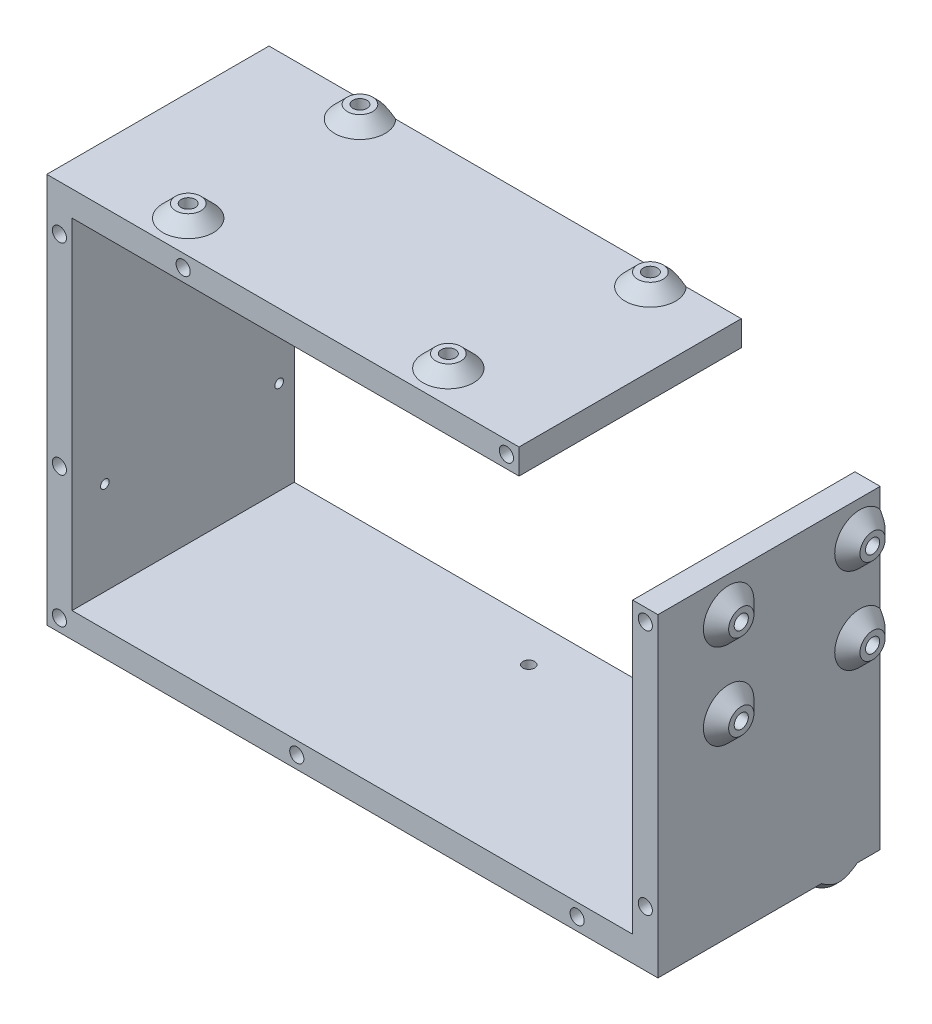
from build123d import *

# Parameters (mm, degrees)
SKETCH1_W                  = 121
SKETCH1_H                  = 77.3
BOX_DEPTH                  = 44
CUTOUT_REACH               = 86.203
SKETCH2_W                  = 111
SKETCH2_H                  = 67.3
TRIM_REACH                 = 86.203
SKETCH4_R                  = 1.4
TOP_SCREWS_DEPTH           = 9.5
SKETCH7_R                  = 2.5
USB_POWER_BOSS_DEPTH       = 2.5
CHAMFER2_SIZE              = 2.5
USB_POWER_SCREWS_REACH     = 131.945
SKETCH8_R                  = 0.85
SKETCH9_R                  = 2.5
MOTOR_DRIVERS_BOSS_DEPTH   = 2.5
CHAMFER3_SIZE              = 2.5
MOTOR_DRIVERS_SCREWS_REACH = 107.51
SKETCH11_R                 = 1.4
SKETCH12_R                 = 2.5
BOSS_EXTRUDE5_DEPTH        = 2.5
CUT_EXTRUDE8_REACH         = 109.238
SKETCH13_R                 = 1.15
CHAMFER4_SIZE              = 2.5
SKETCH14_R                 = 1.4
CHASSIS_SCREWS_DEPTH       = 10
SKETCH15_R                 = 5
LDS_ADAPTER_BOARD_DEPTH    = 2.5
CUT_EXTRUDE10_REACH        = 141.661
SKETCH16_R                 = 1.4


with BuildPart() as part:
    # Sketch1 → Box (new body)
    with BuildSketch(Plane.XY):
        Rectangle(SKETCH1_W, SKETCH1_H)
    extrude(amount=BOX_DEPTH)

    # Sketch2 → Cutout (cut, up to next)
    with BuildSketch(Plane.XY, mode=Mode.PRIVATE) as cutout_sk1:
        Rectangle(SKETCH2_W, SKETCH2_H)
    cutout_tool1 = extrude(cutout_sk1.sketch, amount=CUTOUT_REACH, mode=Mode.PRIVATE) & part.part
    add(cutout_tool1.solids().sort_by_distance((0, 0, 0))[0], mode=Mode.SUBTRACT)

    # Sketch3 → Trim (cut, up to next)
    with BuildSketch(Plane.XY, mode=Mode.PRIVATE) as trim_sk1:
        Polygon((33, 38.65), (33, 33.65), (55.5, 23.65), (60.5, 23.65), (60.5, 38.65), align=None)
    trim_tool1 = extrude(trim_sk1.sketch, amount=TRIM_REACH, mode=Mode.PRIVATE) & part.part
    add(trim_tool1.solids().sort_by_distance((49.09375, 32.7125, 0))[0], mode=Mode.SUBTRACT)

    # Sketch4 → Top screws (cut)
    with BuildSketch(Plane.XY.offset(44)):
        with Locations((-58, -36.15)):
            Circle(SKETCH4_R)
        with Locations((58, -27.65)):
            Circle(SKETCH4_R)
        with Locations((-11, -36.15)):
            Circle(SKETCH4_R)
        with Locations((-58, 29.65)):
            Circle(SKETCH4_R)
        with Locations((-33.5, 36.15)):
            Circle(SKETCH4_R)
        with Locations((30.5, 36.15)):
            Circle(SKETCH4_R)
        with Locations((58, 21.15)):
            Circle(SKETCH4_R)
        with Locations((44.5, -36.15)):
            Circle(SKETCH4_R)
        with Locations((-58, -10.15)):
            Circle(SKETCH4_R)
    extrude(amount=-TOP_SCREWS_DEPTH, mode=Mode.SUBTRACT)

    # Sketch7 → USB power boss (add)
    with BuildSketch(Plane.ZY.offset(60.5)):
        with Locations(Location((3, 32.8, 0), (0, 0, 90))):
            Circle(SKETCH7_R)
        with Locations(Location((37.5, 32.8, 0), (0, 0, 90))):
            Circle(SKETCH7_R)
        with Locations(Location((3, -15.2, 0), (0, 0, 90))):
            Circle(SKETCH7_R)
        with Locations(Location((37.5, -15.2, 0), (0, 0, 90))):
            Circle(SKETCH7_R)
    extrude(amount=USB_POWER_BOSS_DEPTH)

    # Chamfer2
    # the kernel refuses this chamfer: 2.5 mm, written as the material it adds along each edge
    with BuildSketch(Plane(origin=(-60.5, 32.8, 3), x_dir=(0, 1, 0), z_dir=(0, 0, 1))) as chamfer2_piece_1_section:
        Polygon((2.5 + CHAMFER2_SIZE, 0), (2.5, CHAMFER2_SIZE), (2.5, 0), align=None)
    chamfer2_piece_1 = revolve(axis=Axis((-60.5, 32.8, 3), (-1, 0, 0)), mode=Mode.PRIVATE)
    chamfer2_piece_1 = split(chamfer2_piece_1, bisect_by=Plane(origin=(-60.5, 32.8, 0), z_dir=(0, 0, 1)), keep=Keep.TOP, mode=Mode.PRIVATE)
    chamfer2_piece_1 = split(chamfer2_piece_1, bisect_by=Plane(origin=(-63, 32.8, 3), z_dir=(1, 0, 0)), keep=Keep.TOP, mode=Mode.PRIVATE)
    add(chamfer2_piece_1)
    with BuildSketch(Plane(origin=(-60.5, 32.8, 37.5), x_dir=(0, 1, 0), z_dir=(0, 0, 1))) as chamfer2_piece_2_section:
        Polygon((2.5 + CHAMFER2_SIZE, 0), (2.5, CHAMFER2_SIZE), (2.5, 0), align=None)
    chamfer2_piece_2 = revolve(axis=Axis((-60.5, 32.8, 37.5), (-1, 0, 0)), mode=Mode.PRIVATE)
    chamfer2_piece_2 = split(chamfer2_piece_2, bisect_by=Plane(origin=(-63, 32.8, 37.5), z_dir=(1, 0, 0)), keep=Keep.TOP, mode=Mode.PRIVATE)
    add(chamfer2_piece_2)
    with BuildSketch(Plane(origin=(-60.5, -15.2, 3), x_dir=(0, 1, 0), z_dir=(0, 0, 1))) as chamfer2_piece_3_section:
        Polygon((2.5 + CHAMFER2_SIZE, 0), (2.5, CHAMFER2_SIZE), (2.5, 0), align=None)
    chamfer2_piece_3 = revolve(axis=Axis((-60.5, -15.2, 3), (-1, 0, 0)), mode=Mode.PRIVATE)
    chamfer2_piece_3 = split(chamfer2_piece_3, bisect_by=Plane(origin=(-60.5, -15.2, 0), z_dir=(0, 0, 1)), keep=Keep.TOP, mode=Mode.PRIVATE)
    chamfer2_piece_3 = split(chamfer2_piece_3, bisect_by=Plane(origin=(-63, -15.2, 3), z_dir=(1, 0, 0)), keep=Keep.TOP, mode=Mode.PRIVATE)
    add(chamfer2_piece_3)
    with BuildSketch(Plane(origin=(-60.5, -15.2, 37.5), x_dir=(0, 1, 0), z_dir=(0, 0, 1))) as chamfer2_piece_4_section:
        Polygon((2.5 + CHAMFER2_SIZE, 0), (2.5, CHAMFER2_SIZE), (2.5, 0), align=None)
    chamfer2_piece_4 = revolve(axis=Axis((-60.5, -15.2, 37.5), (-1, 0, 0)), mode=Mode.PRIVATE)
    chamfer2_piece_4 = split(chamfer2_piece_4, bisect_by=Plane(origin=(-63, -15.2, 37.5), z_dir=(1, 0, 0)), keep=Keep.TOP, mode=Mode.PRIVATE)
    add(chamfer2_piece_4)

    # Sketch8 → USB power screws (cut, up to next)
    with BuildSketch(Plane(origin=(-55.5, 0, 0), x_dir=(0, 0, -1), z_dir=(1, 0, 0)), mode=Mode.PRIVATE) as usb_power_screws_sk1:
        with Locations((-3, -15.2)):
            Circle(SKETCH8_R)
    usb_power_screws_tool1 = extrude(usb_power_screws_sk1.sketch, amount=-USB_POWER_SCREWS_REACH, mode=Mode.PRIVATE) & part.part
    # Sketch8 → USB power screws (cut, up to next)
    with BuildSketch(Plane(origin=(-55.5, 0, 0), x_dir=(0, 0, -1), z_dir=(1, 0, 0)), mode=Mode.PRIVATE) as usb_power_screws_sk2:
        with Locations((-37.5, -15.2)):
            Circle(SKETCH8_R)
    usb_power_screws_tool2 = extrude(usb_power_screws_sk2.sketch, amount=-USB_POWER_SCREWS_REACH, mode=Mode.PRIVATE) & part.part
    # Sketch8 → USB power screws (cut, up to next)
    with BuildSketch(Plane(origin=(-55.5, 0, 0), x_dir=(0, 0, -1), z_dir=(1, 0, 0)), mode=Mode.PRIVATE) as usb_power_screws_sk3:
        with Locations(Location((-3, 32.8, 0), (0, 0, 90))):
            Circle(SKETCH8_R)
    usb_power_screws_tool3 = extrude(usb_power_screws_sk3.sketch, amount=-USB_POWER_SCREWS_REACH, mode=Mode.PRIVATE) & part.part
    # Sketch8 → USB power screws (cut, up to next)
    with BuildSketch(Plane(origin=(-55.5, 0, 0), x_dir=(0, 0, -1), z_dir=(1, 0, 0)), mode=Mode.PRIVATE) as usb_power_screws_sk4:
        with Locations(Location((-37.5, 32.8, 0), (0, 0, 90))):
            Circle(SKETCH8_R)
    usb_power_screws_tool4 = extrude(usb_power_screws_sk4.sketch, amount=-USB_POWER_SCREWS_REACH, mode=Mode.PRIVATE) & part.part
    add(usb_power_screws_tool1.solids().sort_by_distance((-55.5, -15.2, 3))[0], mode=Mode.SUBTRACT)
    add(usb_power_screws_tool2.solids().sort_by_distance((-55.5, -15.2, 37.5))[0], mode=Mode.SUBTRACT)
    add(usb_power_screws_tool3.solids().sort_by_distance((-55.5, 32.8, 3))[0], mode=Mode.SUBTRACT)
    add(usb_power_screws_tool4.solids().sort_by_distance((-55.5, 32.8, 37.5))[0], mode=Mode.SUBTRACT)

    # Sketch9 → Motor drivers boss (add)
    with BuildSketch(Plane(origin=(0, 38.65, 0), x_dir=(1, 0, 0), z_dir=(0, 1, 0))):
        with Locations(Location((-39, -37.5, 0), (0, 0, 90))):
            Circle(SKETCH9_R)
        with Locations(Location((-39, -3.5, 0), (0, 0, 90))):
            Circle(SKETCH9_R)
        with Locations(Location((18.5, -3.5, 0), (0, 0, 90))):
            Circle(SKETCH9_R)
        with Locations(Location((12.5, -37.5, 0), (0, 0, 90))):
            Circle(SKETCH9_R)
    extrude(amount=MOTOR_DRIVERS_BOSS_DEPTH)

    # Chamfer3
    # the kernel refuses this chamfer: 2.5 mm, written as the material it adds along each edge
    with BuildSketch(Plane(origin=(-39, 38.65, 37.5), x_dir=(0, 0, -1), z_dir=(1, 0, 0))) as chamfer3_piece_1_section:
        Polygon((2.5 + CHAMFER3_SIZE, 0), (2.5, CHAMFER3_SIZE), (2.5, 0), align=None)
    chamfer3_piece_1 = revolve(axis=Axis((-39, 38.65, 37.5), (0, 1, 0)), mode=Mode.PRIVATE)
    chamfer3_piece_1 = split(chamfer3_piece_1, bisect_by=Plane(origin=(-39, 41.15, 37.5), z_dir=(0, -1, 0)), keep=Keep.TOP, mode=Mode.PRIVATE)
    add(chamfer3_piece_1)
    with BuildSketch(Plane(origin=(-39, 38.65, 3.5), x_dir=(0, 0, -1), z_dir=(1, 0, 0))) as chamfer3_piece_2_section:
        Polygon((2.5 + CHAMFER3_SIZE, 0), (2.5, CHAMFER3_SIZE), (2.5, 0), align=None)
    chamfer3_piece_2 = revolve(axis=Axis((-39, 38.65, 3.5), (0, 1, 0)), mode=Mode.PRIVATE)
    chamfer3_piece_2 = split(chamfer3_piece_2, bisect_by=Plane(origin=(-39, 38.65, 0), z_dir=(0, 0, 1)), keep=Keep.TOP, mode=Mode.PRIVATE)
    chamfer3_piece_2 = split(chamfer3_piece_2, bisect_by=Plane(origin=(-39, 41.15, 3.5), z_dir=(0, -1, 0)), keep=Keep.TOP, mode=Mode.PRIVATE)
    add(chamfer3_piece_2)
    with BuildSketch(Plane(origin=(18.5, 38.65, 3.5), x_dir=(0, 0, -1), z_dir=(1, 0, 0))) as chamfer3_piece_3_section:
        Polygon((2.5 + CHAMFER3_SIZE, 0), (2.5, CHAMFER3_SIZE), (2.5, 0), align=None)
    chamfer3_piece_3 = revolve(axis=Axis((18.5, 38.65, 3.5), (0, 1, 0)), mode=Mode.PRIVATE)
    chamfer3_piece_3 = split(chamfer3_piece_3, bisect_by=Plane(origin=(18.5, 38.65, 0), z_dir=(0, 0, 1)), keep=Keep.TOP, mode=Mode.PRIVATE)
    chamfer3_piece_3 = split(chamfer3_piece_3, bisect_by=Plane(origin=(18.5, 41.15, 3.5), z_dir=(0, -1, 0)), keep=Keep.TOP, mode=Mode.PRIVATE)
    add(chamfer3_piece_3)
    with BuildSketch(Plane(origin=(12.5, 38.65, 37.5), x_dir=(0, 0, -1), z_dir=(1, 0, 0))) as chamfer3_piece_4_section:
        Polygon((2.5 + CHAMFER3_SIZE, 0), (2.5, CHAMFER3_SIZE), (2.5, 0), align=None)
    chamfer3_piece_4 = revolve(axis=Axis((12.5, 38.65, 37.5), (0, 1, 0)), mode=Mode.PRIVATE)
    chamfer3_piece_4 = split(chamfer3_piece_4, bisect_by=Plane(origin=(12.5, 41.15, 37.5), z_dir=(0, -1, 0)), keep=Keep.TOP, mode=Mode.PRIVATE)
    add(chamfer3_piece_4)

    # Sketch11 → Motor drivers screws (cut, up to next)
    with BuildSketch(Plane.XZ.offset(-33.65), mode=Mode.PRIVATE) as motor_drivers_screws_sk1:
        with Locations(Location((12.5, 37.5, 0), (0, 0, 270))):
            Circle(SKETCH11_R)
    motor_drivers_screws_tool1 = extrude(motor_drivers_screws_sk1.sketch, amount=-MOTOR_DRIVERS_SCREWS_REACH, mode=Mode.PRIVATE) & part.part
    # Sketch11 → Motor drivers screws (cut, up to next)
    with BuildSketch(Plane.XZ.offset(-33.65), mode=Mode.PRIVATE) as motor_drivers_screws_sk2:
        with Locations(Location((18.5, 3.5, 0), (0, 0, 270))):
            Circle(SKETCH11_R)
    motor_drivers_screws_tool2 = extrude(motor_drivers_screws_sk2.sketch, amount=-MOTOR_DRIVERS_SCREWS_REACH, mode=Mode.PRIVATE) & part.part
    # Sketch11 → Motor drivers screws (cut, up to next)
    with BuildSketch(Plane.XZ.offset(-33.65), mode=Mode.PRIVATE) as motor_drivers_screws_sk3:
        with Locations(Location((-39, 3.5, 0), (0, 0, 270))):
            Circle(SKETCH11_R)
    motor_drivers_screws_tool3 = extrude(motor_drivers_screws_sk3.sketch, amount=-MOTOR_DRIVERS_SCREWS_REACH, mode=Mode.PRIVATE) & part.part
    # Sketch11 → Motor drivers screws (cut, up to next)
    with BuildSketch(Plane.XZ.offset(-33.65), mode=Mode.PRIVATE) as motor_drivers_screws_sk4:
        with Locations(Location((-39, 37.5, 0), (0, 0, 270))):
            Circle(SKETCH11_R)
    motor_drivers_screws_tool4 = extrude(motor_drivers_screws_sk4.sketch, amount=-MOTOR_DRIVERS_SCREWS_REACH, mode=Mode.PRIVATE) & part.part
    add(motor_drivers_screws_tool1.solids().sort_by_distance((12.5, 33.65, 37.5))[0], mode=Mode.SUBTRACT)
    add(motor_drivers_screws_tool2.solids().sort_by_distance((18.5, 33.65, 3.5))[0], mode=Mode.SUBTRACT)
    add(motor_drivers_screws_tool3.solids().sort_by_distance((-39, 33.65, 3.5))[0], mode=Mode.SUBTRACT)
    add(motor_drivers_screws_tool4.solids().sort_by_distance((-39, 33.65, 37.5))[0], mode=Mode.SUBTRACT)

    # Sketch12 → Boss-Extrude5 (add)
    with BuildSketch(Plane.XZ.offset(38.65)):
        with Locations(Location((-1, 8.0765, 0), (0, 0, 90))):
            Circle(SKETCH12_R)
        with Locations(Location((57, 8.0765, 0), (0, 0, 90))):
            Circle(SKETCH12_R)
    extrude(amount=BOSS_EXTRUDE5_DEPTH)

    # Sketch13 → Cut-Extrude8 (cut, up to next)
    with BuildSketch(Plane.XZ.offset(33.65), mode=Mode.PRIVATE) as cut_extrude8_sk1:
        with Locations(Location((-1, 8.0765, 0), (0, 0, 270))):
            Circle(SKETCH13_R)
    cut_extrude8_tool1 = extrude(cut_extrude8_sk1.sketch, amount=CUT_EXTRUDE8_REACH, mode=Mode.PRIVATE) & part.part
    # Sketch13 → Cut-Extrude8 (cut, up to next)
    with BuildSketch(Plane.XZ.offset(33.65), mode=Mode.PRIVATE) as cut_extrude8_sk2:
        with Locations(Location((57, 8.0765, 0), (0, 0, 270))):
            Circle(SKETCH13_R)
    cut_extrude8_tool2 = extrude(cut_extrude8_sk2.sketch, amount=CUT_EXTRUDE8_REACH, mode=Mode.PRIVATE) & part.part
    add(cut_extrude8_tool1.solids().sort_by_distance((-1, -33.65, 8.0765))[0], mode=Mode.SUBTRACT)
    add(cut_extrude8_tool2.solids().sort_by_distance((57, -33.65, 8.0765))[0], mode=Mode.SUBTRACT)

    # Chamfer4
    # the kernel refuses this chamfer: 2.5 mm, written as the material it adds along each edge
    with BuildSketch(Plane(origin=(-1, -38.65, 8.0765), x_dir=(0, 0, 1), z_dir=(1, 0, 0))) as chamfer4_piece_1_section:
        Polygon((2.5 + CHAMFER4_SIZE, 0), (2.5, CHAMFER4_SIZE), (2.5, 0), align=None)
    chamfer4_piece_1 = revolve(axis=Axis((-1, -38.65, 8.0765), (0, -1, 0)), mode=Mode.PRIVATE)
    chamfer4_piece_1 = split(chamfer4_piece_1, bisect_by=Plane(origin=(-1, -41.15, 8.0765), z_dir=(0, 1, 0)), keep=Keep.TOP, mode=Mode.PRIVATE)
    add(chamfer4_piece_1)
    with BuildSketch(Plane(origin=(57, -38.65, 8.0765), x_dir=(0, 0, 1), z_dir=(1, 0, 0))) as chamfer4_piece_2_section:
        Polygon((2.5 + CHAMFER4_SIZE, 0), (2.5, CHAMFER4_SIZE), (2.5, 0), align=None)
    chamfer4_piece_2 = revolve(axis=Axis((57, -38.65, 8.0765), (0, -1, 0)), mode=Mode.PRIVATE)
    chamfer4_piece_2 = split(chamfer4_piece_2, bisect_by=Plane(origin=(60.5, -38.65, 8.0765), z_dir=(-1, 0, 0)), keep=Keep.TOP, mode=Mode.PRIVATE)
    chamfer4_piece_2 = split(chamfer4_piece_2, bisect_by=Plane(origin=(57, -41.15, 8.0765), z_dir=(0, 1, 0)), keep=Keep.TOP, mode=Mode.PRIVATE)
    add(chamfer4_piece_2)

    # Sketch14 → Chassis screws (cut)
    with BuildSketch(Plane.XY):
        with Locations((53, -36.15)):
            Circle(SKETCH14_R)
        with Locations((58, -29.15)):
            Circle(SKETCH14_R)
        with Locations((58, 20.65)):
            Circle(SKETCH14_R)
        with Locations((30, 36.15)):
            Circle(SKETCH14_R)
        with Locations((2, 36.15)):
            Circle(SKETCH14_R)
        with Locations((-4, 36.15)):
            Circle(SKETCH14_R)
        with Locations((-48, 36.15)):
            Circle(SKETCH14_R)
        with Locations((-58, 26.15)):
            Circle(SKETCH14_R)
        with Locations((-58, -30.15)):
            Circle(SKETCH14_R)
        with Locations((-53, -36.15)):
            Circle(SKETCH14_R)
        with Locations((-7, -36.15)):
            Circle(SKETCH14_R)
    extrude(amount=CHASSIS_SCREWS_DEPTH, mode=Mode.SUBTRACT)

    # Sketch15 → LDS adapter board (add)
    with BuildSketch(Plane(origin=(60.5, 0, 0), x_dir=(0, 0, -1), z_dir=(1, 0, 0))):
        with Locations(Location((-30, -0.35, 0), (0, 0, 270))):
            Circle(SKETCH15_R)
        with Locations(Location((-30, 16.65, 0), (0, 0, 270))):
            Circle(SKETCH15_R)
        with BuildLine():
            Line((0, -3.35), (0, 2.65))
            ThreePointArc((0, 2.65), (-9, -0.35), (0, -3.35))
        make_face()
        with BuildLine():
            Line((0, 13.65), (0, 19.65))
            ThreePointArc((0, 19.65), (-9, 16.65), (0, 13.65))
        make_face()
    extrude(amount=LDS_ADAPTER_BOARD_DEPTH)

    # Sketch16 → Cut-Extrude10 (cut, up to next)
    with BuildSketch(Plane(origin=(63, 0, 0), x_dir=(0, 0, -1), z_dir=(1, 0, 0)), mode=Mode.PRIVATE) as cut_extrude10_sk1:
        with Locations(Location((-30, -0.35, 0), (0, 0, 90))):
            Circle(SKETCH16_R)
    cut_extrude10_tool1 = extrude(cut_extrude10_sk1.sketch, amount=-CUT_EXTRUDE10_REACH, mode=Mode.PRIVATE) & part.part
    # Sketch16 → Cut-Extrude10 (cut, up to next)
    with BuildSketch(Plane(origin=(63, 0, 0), x_dir=(0, 0, -1), z_dir=(1, 0, 0)), mode=Mode.PRIVATE) as cut_extrude10_sk2:
        with Locations(Location((-30, 16.65, 0), (0, 0, 90))):
            Circle(SKETCH16_R)
    cut_extrude10_tool2 = extrude(cut_extrude10_sk2.sketch, amount=-CUT_EXTRUDE10_REACH, mode=Mode.PRIVATE) & part.part
    # Sketch16 → Cut-Extrude10 (cut, up to next)
    with BuildSketch(Plane(origin=(63, 0, 0), x_dir=(0, 0, -1), z_dir=(1, 0, 0)), mode=Mode.PRIVATE) as cut_extrude10_sk3:
        with Locations(Location((-4, 16.65, 0), (0, 0, 90))):
            Circle(SKETCH16_R)
    cut_extrude10_tool3 = extrude(cut_extrude10_sk3.sketch, amount=-CUT_EXTRUDE10_REACH, mode=Mode.PRIVATE) & part.part
    # Sketch16 → Cut-Extrude10 (cut, up to next)
    with BuildSketch(Plane(origin=(63, 0, 0), x_dir=(0, 0, -1), z_dir=(1, 0, 0)), mode=Mode.PRIVATE) as cut_extrude10_sk4:
        with Locations(Location((-4, -0.35, 0), (0, 0, 90))):
            Circle(SKETCH16_R)
    cut_extrude10_tool4 = extrude(cut_extrude10_sk4.sketch, amount=-CUT_EXTRUDE10_REACH, mode=Mode.PRIVATE) & part.part
    add(cut_extrude10_tool1.solids().sort_by_distance((63, -0.35, 30))[0], mode=Mode.SUBTRACT)
    add(cut_extrude10_tool2.solids().sort_by_distance((63, 16.65, 30))[0], mode=Mode.SUBTRACT)
    add(cut_extrude10_tool3.solids().sort_by_distance((63, 16.65, 4))[0], mode=Mode.SUBTRACT)
    add(cut_extrude10_tool4.solids().sort_by_distance((63, -0.35, 4))[0], mode=Mode.SUBTRACT)

    # Chamfer5: read off the stored shape, not the designer's step
    # Chamfer5 outline → Chamfer5 (revolve, cut)
    with BuildSketch(Plane(origin=(0, -0.35, 4), x_dir=(0, 1, 0), z_dir=(0, 0, -1))):
        Polygon((5, 63), (2.5, 63), (5, 60.5), align=None)
    revolve(axis=Axis((0, -0.35, 4), (1, 0, 0)), mode=Mode.SUBTRACT)

    # Chamfer5 2 outline → Chamfer5 2 (revolve, cut)
    with BuildSketch(Plane(origin=(0, 16.65, 4), x_dir=(0, 1, 0), z_dir=(0, 0, -1))):
        Polygon((5, 63), (2.5, 63), (5, 60.5), align=None)
    revolve(axis=Axis((0, 16.65, 4), (1, 0, 0)), mode=Mode.SUBTRACT)

    # Chamfer5 3 outline → Chamfer5 3 (revolve, cut)
    with BuildSketch(Plane(origin=(0, 16.65, 30), x_dir=(0, 1, 0), z_dir=(0, 0, -1))):
        Polygon((5, 63), (2.5, 63), (5, 60.5), align=None)
    revolve(axis=Axis((0, 16.65, 30), (1, 0, 0)), mode=Mode.SUBTRACT)

    # Chamfer5 4 outline → Chamfer5 4 (revolve, cut)
    with BuildSketch(Plane(origin=(0, -0.35, 30), x_dir=(0, 1, 0), z_dir=(0, 0, -1))):
        Polygon((5, 63), (2.5, 63), (5, 60.5), align=None)
    revolve(axis=Axis((0, -0.35, 30), (1, 0, 0)), mode=Mode.SUBTRACT)


solid = part.part
